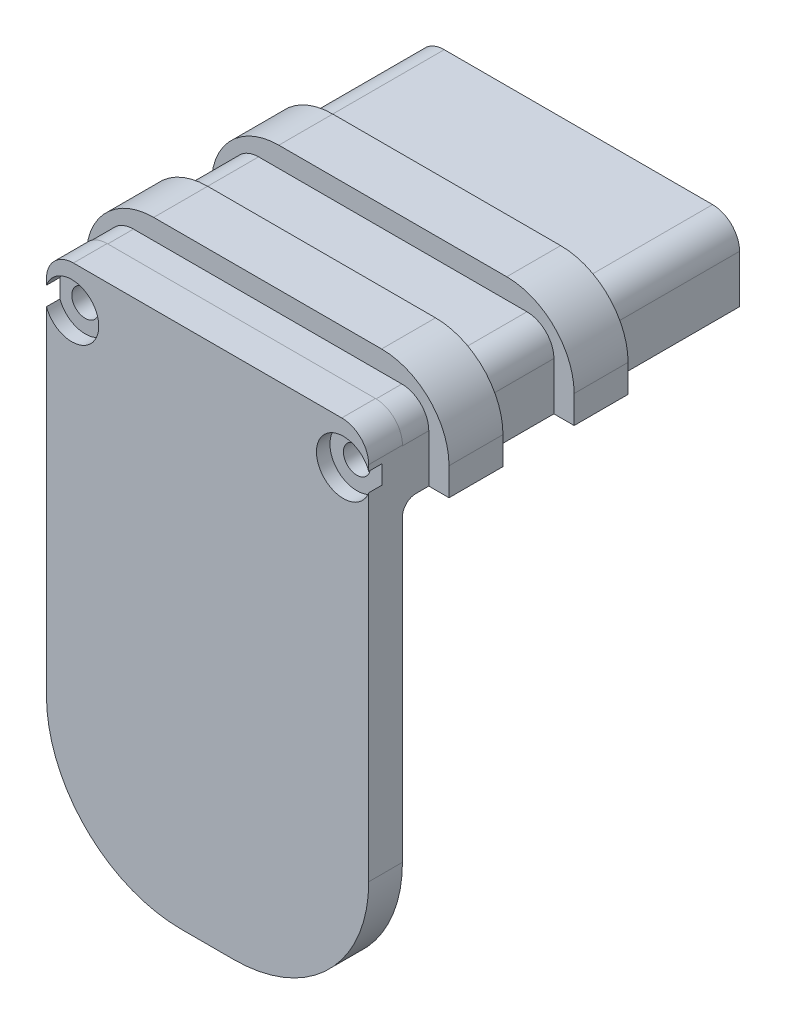
from build123d import *

# Parameters (mm, degrees)
SKETCH_1_W                = 32.6
SKETCH_1_H                = 34.6
SKETCH_1_R                = 1.25
SKETCH_1_W_2              = 24.6
SKETCH_1_H_2              = 24.2
EXTRUDE_1_DEPTH           = 13
SKETCH_3_W                = 6.5
SKETCH_3_H                = 6.519005167
CUT_EXTRUDE_1_DEPTH       = 19
SKETCH_4_W                = 6.5
SKETCH_4_H                = 6.467668889
CUT_EXTRUDE_2_DEPTH       = 23
EXTRUDE_2_DEPTH           = 50
SKETCH_1_2_W              = 22.27659965
SKETCH_1_2_H              = 4.598586669
SKETCH_1_2_W_2            = 22.283050596
SKETCH_1_2_H_2            = 4.977540741
CUT_EXTRUDE_5_DEPTH       = 34
FILLET_1_R                = 2
FILLET_2_R                = 2
SKETCH_9_W                = 54.594998093
SKETCH_9_H                = 18.111982385
SKETCH_9_W_2              = 52.534809486
SKETCH_9_H_2              = 12.989301534
CUT_EXTRUDE_6_DEPTH       = 41
FILLET_6_R                = 22
EXTRUDE_4_DEPTH           = 13
SKETCH_13_W               = 5.518907879
SKETCH_13_H               = 8.361822047
CUT_EXTRUDE_8_DEPTH       = 8.5
SKETCH_14_W               = 6.038657432
SKETCH_14_H               = 7.741248121
CUT_EXTRUDE_9_DEPTH       = 8.5
SKETCH_23_OUTSIDE_W       = 35.102
SKETCH_23_OUTSIDE_H       = 56.702
SKETCH_23_OUTSIDE_W_2     = 1.5
SKETCH_23_OUTSIDE_H_2     = 34.6
CUT_EXTRUDE_10_DEPTH      = 104
SKETCH_24_W               = 10.341780897
SKETCH_24_H               = 5.2
SKETCH_24_R               = 1.25
EXTRUDE_5_DEPTH           = 1.5
SKETCH_25_R               = 1.25
CUT_EXTRUDE_11_DEPTH      = 104
SKETCH_26_OUTSIDE_W       = 115.402
SKETCH_26_OUTSIDE_H       = 56.536
SKETCH_26_OUTSIDE_W_2     = 17.268409177
SKETCH_26_OUTSIDE_H_2     = 34.6
CUT_EXTRUDE_12_DEPTH      = 10
SKETCH_27_W               = 2.368409177
SKETCH_27_H               = 25.781356428
EXTRUDE_6_DEPTH           = 1.5
SKETCH_28_R               = 1.25
CUT_EXTRUDE_13_DEPTH      = 10
CUT_EXTRUDE_START         = -1.5
CUT_EXTRUDE_14_OUTLINE_W  = 0.368409177
CUT_EXTRUDE_14_OUTLINE_H  = 34.6
CUT_EXTRUDE_14_DEPTH      = 1.5
SKETCH_30_R               = 1
SKETCH_30_W               = 15.411127821
SKETCH_30_H               = 34.6
EXTRUDE_7_DEPTH           = 1.5
SKETCH_33_W               = 23.9
SKETCH_33_H               = 38.011921137
SKETCH_33_R               = 1.25
SKETCH_33_R_2             = 1
EXTRUDE_8_DEPTH           = 15
SKETCH_34_OUTSIDE_W       = 35.468
SKETCH_34_OUTSIDE_H       = 49.58
SKETCH_34_OUTSIDE_W_2     = 15.945908464
SKETCH_34_OUTSIDE_H_2     = 43.183358486
CUT_EXTRUDE_15_DEPTH      = 13.5
SKETCH_35_W               = 12.9
SKETCH_35_H               = 31.784162084
CUT_EXTRUDE_16_DEPTH      = 9.5
SKETCH_37_R               = 2.45
EXTRUDE_9_DEPTH           = 6.5
SKETCH_39_W               = 13.171271293
SKETCH_39_H               = 32.937459588
CUT_EXTRUDE_17_DEPTH      = 3
SKETCH_40_R               = 1
EXTRUDE_10_DEPTH          = 2.5
CUT_EXTRUDE_18_DEPTH      = 39.46624694
CUT_EXTRUDE_18_DEPTH_BACK = 39.46624694
SKETCH_41_W               = 23.981836835
SKETCH_41_H               = 47.1912102
SKETCH_42_R               = 2.4
EXTRUDE_11_DEPTH          = 5
FILLET_7_R                = 10
SKETCH_43_R               = 0.960722285
SKETCH_43_R_2             = 1
EXTRUDE_12_DEPTH          = 25
FILLET_9_R                = 2
SKETCH_44_R               = 2
CUT_EXTRUDE_19_DEPTH      = 1
SKETCH_45_W               = 26.9
SKETCH_45_H               = 4
EXTRUDE_13_DEPTH          = 1.5
SKETCH_46_W               = 1.5
SKETCH_46_H               = 4
EXTRUDE_14_DEPTH          = 5.557466787
FILLET_11_R               = 5
FILLET_14_R               = 1
FILLET_15_R               = 2
FILLET_16_R               = 2
FILLET_17_R               = 2
FILLET_18_R               = 2
FILLET_19_R               = 2
FILLET_20_R               = 2
FILLET_21_R               = 2
FILLET_22_R               = 2
SKETCH_47_R               = 5.136959448
EXTRUDE_15_DEPTH          = 1
FILLET_23_R               = 1
FILLET_24_R               = 0.5


# Read off the part's stored shape, not the designer's step: 切除-拉伸14
# Some blends are built 0.0001 mm under size
with BuildPart() as part:
    # Sketch 1 → 凸台-拉伸1 (new body)
    with BuildSketch(Plane.XY):
        with Locations((-9.850980392, 1.274712581)):
            Rectangle(SKETCH_1_W, SKETCH_1_H)
        with Locations(Location((-15.700980392, 15.424712581, 0), (0, 0, 180))):
            Circle(SKETCH_1_R, mode=Mode.SUBTRACT)
        with Locations(Location((-3.600980392, 15.424712581, 0), (0, 0, 180))):
            Circle(SKETCH_1_R, mode=Mode.SUBTRACT)
        with Locations(Location((-15.700980392, -12.875287419, 0), (0, 0, 180))):
            Circle(SKETCH_1_R, mode=Mode.SUBTRACT)
        with Locations(Location((-3.600980392, -12.875287419, 0), (0, 0, 180))):
            Circle(SKETCH_1_R, mode=Mode.SUBTRACT)
        with Locations((-9.850980392, 1.274712581)):
            Rectangle(SKETCH_1_W_2, SKETCH_1_H_2, mode=Mode.SUBTRACT)
    extrude(amount=EXTRUDE_1_DEPTH)

    # 草图3 → 切除-拉伸1 (cut)
    with BuildSketch(Plane(origin=(0, 0, 0), x_dir=(-1, 0, 0), z_dir=(0, 0, -1))):
        with Locations((15.700980392, -10.82528742)):
            Rectangle(SKETCH_3_W, SKETCH_3_H)
    extrude(amount=-CUT_EXTRUDE_1_DEPTH, mode=Mode.SUBTRACT)

    # 草图4 → 切除-拉伸2 (cut)
    with BuildSketch(Plane.XY.offset(13)):
        with Locations((-3.600980392, -10.82528742)):
            Rectangle(SKETCH_4_W, SKETCH_4_H)
    extrude(amount=-CUT_EXTRUDE_2_DEPTH, mode=Mode.SUBTRACT)

    # 草图5 → 凸台-拉伸2 (add)
    with BuildSketch(Plane(origin=(6.449019608, 0, 0), x_dir=(0, 0, -1), z_dir=(1, 0, 0))):
        Polygon((-13, 18.574712581), (-13, 10.055461473), (-13, -16.025287419), (0, -16.025287419), (0, -15.027567927), (0, 16.282461831), (0, 18.574712581), align=None)
    extrude(amount=EXTRUDE_2_DEPTH)

    # Sketch 1 2 → 切除-拉伸5 (cut)
    with BuildSketch(Plane.XY.offset(13)):
        with Locations((24.037173058, -7.263594431)):
            Rectangle(SKETCH_1_2_W, SKETCH_1_2_H)
        with Locations((24.078382453, 0.81654228)):
            Rectangle(SKETCH_1_2_W_2, SKETCH_1_2_H_2)
    extrude(amount=-CUT_EXTRUDE_5_DEPTH, mode=Mode.SUBTRACT)

    # 圆角1
    fillet_1_edges = [part.edges().sort_by_distance(p)[0] for p in [
        (12.936857155, -1.672228091, 6.5),
        (12.936857155, 3.30531265, 6.5),
        (35.219907751, 3.30531265, 6.5),
        (35.219907751, -1.672228091, 6.5),
        (12.898873233, -9.562887765, 6.5),
        (12.898873233, -4.964301096, 6.5),
        (35.175472883, -4.964301096, 6.5),
        (35.175472883, -9.562887765, 6.5),
    ]]
    fillet(fillet_1_edges, radius=FILLET_1_R)

    # 圆角2
    fillet_2_edges = [part.edges().sort_by_distance(p)[0] for p in [
        (-26.150980392, -16.025287419, 6.5),
        (-26.150980392, 18.574712581, 6.5),
    ]]
    fillet(fillet_2_edges, radius=FILLET_2_R)

    # 草图9 → 切除-拉伸6 (cut)
    with BuildSketch(Plane(origin=(0, 0, 0), x_dir=(-1, 0, 0), z_dir=(0, 0, -1))):
        with Locations((-36.934177516, 16.051357777)):
            Rectangle(SKETCH_9_W, SKETCH_9_H)
        with Locations((-36.653242706, -19.247200889)):
            Rectangle(SKETCH_9_W_2, SKETCH_9_H_2)
    extrude(amount=-CUT_EXTRUDE_6_DEPTH, mode=Mode.SUBTRACT)

    # 圆角6
    # the kernel refuses this fillet: 22 mm, written as the material it adds along each edge
    with BuildSketch(Plane(origin=(9.636678469, 6.995366584, 0), x_dir=(0, 1, 0), z_dir=(0, 0, 1))) as fillet_6_piece_1:
        with BuildLine():
            CenterArc((22, -19.375499223), FILLET_6_R, 118.272534833, 61.727465167)
            Line((0, -19.375499223), (-0.44, -19.375499223))
            Line((-0.44, -19.375499223), (-0.44, 0))
            Line((-0.44, 0), (0, 0.44))
            ThreePointArc((0, 0.44), (5.789672998, 0.44), (11.370932916, 0.387509984))
            Line((11.370932916, 0.387509984), (11.579345996, 0))
        make_face()
    extrude(amount=13)
    with BuildSketch(Plane(origin=(10.385837963, -12.752550122, 0), x_dir=(1, 0, 0), z_dir=(0, 0, 1))) as fillet_6_piece_2:
        with BuildLine():
            CenterArc((11.54511289, -22), FILLET_6_R, 90, 31.653290012)
            Line((0, -3.272737297), (-0.230902258, -2.898192043))
            ThreePointArc((-0.230902258, -2.898192043), (-0.44, -1.636368649), (-0.44, 0))
            Line((-0.44, 0), (0, 0.44))
            Line((0, 0.44), (11.54511289, 0.44))
            Line((11.54511289, 0.44), (11.54511289, 0))
        make_face()
    extrude(amount=13)

    # 草图12 → 凸台-拉伸4 (add)
    with BuildSketch(Plane(origin=(0, 0, 0), x_dir=(-1, 0, 0), z_dir=(0, 0, -1))):
        with BuildLine():
            Line((24.150980392, 18.574712581), (24.496655084, -15.99518818))
            ThreePointArc((24.496655084, -15.99518818), (37.015647173, 1.416671567), (24.150980392, 18.574712581))
        make_face()
        with BuildLine():
            Line((26.822698684, 1.289948959), (26.822698684, -8.431688638))
            ThreePointArc((26.822698684, -8.431688638), (32.027920461, 1.289948959), (26.822698684, 11.011586556))
            Line((26.822698684, 11.011586556), (26.822698684, 1.289948959))
        make_face(mode=Mode.SUBTRACT)
    extrude(amount=-EXTRUDE_4_DEPTH)

    # 草图13 → 切除-拉伸8 (cut)
    with BuildSketch(Plane.XY.offset(13)):
        with Locations((-3.600980393, 15.424712581)):
            Rectangle(SKETCH_13_W, SKETCH_13_H)
    extrude(amount=-CUT_EXTRUDE_8_DEPTH, mode=Mode.SUBTRACT)

    # 草图14 → 切除-拉伸9 (cut)
    with BuildSketch(Plane(origin=(0, 0, 0), x_dir=(-1, 0, 0), z_dir=(0, 0, -1))):
        with Locations((15.700980392, 15.424712581)):
            Rectangle(SKETCH_14_W, SKETCH_14_H)
    extrude(amount=-CUT_EXTRUDE_9_DEPTH, mode=Mode.SUBTRACT)

    # 草图23 outside → 切除-拉伸10 (cut)
    with BuildSketch(Plane(origin=(56.449019608, 0, 0), x_dir=(0, 0, -1), z_dir=(1, 0, 0))):
        with Locations((-6.5, 1.275)):
            Rectangle(SKETCH_23_OUTSIDE_W, SKETCH_23_OUTSIDE_H)
        with Locations((-12.25, 1.274712581)):
            Rectangle(SKETCH_23_OUTSIDE_W_2, SKETCH_23_OUTSIDE_H_2, mode=Mode.SUBTRACT)
    extrude(amount=-CUT_EXTRUDE_10_DEPTH, mode=Mode.SUBTRACT)

    # 草图24 → 凸台-拉伸5 (add)
    with BuildSketch(Plane.XY.offset(13)):
        with Locations((-4.17557206, 15.974712581)):
            Rectangle(SKETCH_24_W, SKETCH_24_H)
        with Locations((-3.600980392, 15.429779286)):
            Circle(SKETCH_24_R, mode=Mode.SUBTRACT)
    extrude(amount=-EXTRUDE_5_DEPTH)

    # 草图25 → 切除-拉伸11 (cut)
    with BuildSketch(Plane.XY.offset(13)):
        with Locations((42.624971711, -3.793205976)):
            Circle(SKETCH_25_R)
        with Locations((-34.434765713, 1.289948959)):
            Circle(SKETCH_25_R)
        with Locations((-25.484048207, 14.316394652)):
            Circle(SKETCH_25_R)
        with Locations((-25.484048207, -12.050711449)):
            Circle(SKETCH_25_R)
    extrude(amount=-CUT_EXTRUDE_11_DEPTH, mode=Mode.SUBTRACT)

    # 草图26 outside → 切除-拉伸12 (cut)
    with BuildSketch(Plane.XY.offset(13)):
        with Locations((9.716, 1.275)):
            Rectangle(SKETCH_26_OUTSIDE_W, SKETCH_26_OUTSIDE_H)
        with Locations((-15.516775803, 1.274712581)):
            Rectangle(SKETCH_26_OUTSIDE_W_2, SKETCH_26_OUTSIDE_H_2, mode=Mode.SUBTRACT)
    extrude(amount=-CUT_EXTRUDE_12_DEPTH, mode=Mode.SUBTRACT)

    # 草图27 → 凸台-拉伸6 (add)
    with BuildSketch(Plane.XY.offset(13)):
        with Locations((-8.066775804, 0.484034367)):
            Rectangle(SKETCH_27_W, SKETCH_27_H)
    extrude(amount=-EXTRUDE_6_DEPTH)

    # 草图28 → 切除-拉伸13 (cut)
    with BuildSketch(Plane.XY.offset(13)):
        with Locations((-19.200980392, 15.384992379)):
            Circle(SKETCH_28_R)
        with Locations((-12.200980392, 15.384992379)):
            Circle(SKETCH_28_R)
    extrude(amount=-CUT_EXTRUDE_13_DEPTH, mode=Mode.SUBTRACT)

    # 切除-拉伸14 outline → 切除-拉伸14 (cut)
    with BuildSketch(Plane.XY.offset(13).offset(CUT_EXTRUDE_START)):
        with Locations((-7.066775804, 1.274712581)):
            Rectangle(CUT_EXTRUDE_14_OUTLINE_W, CUT_EXTRUDE_14_OUTLINE_H)
    extrude(amount=CUT_EXTRUDE_14_DEPTH, mode=Mode.SUBTRACT)

    # 草图30 → 凸台-拉伸7 (add)
    with BuildSketch(Plane.XY.offset(13)):
        Polygon((-27.650980392, 18.574712581), (-27.650980392, -16.025287419), (-27.650980392, -17.319235473), (-3.750980392, -17.319235473), (-3.750980392, -16.025287419), (-3.750980392, 18.574712581), (-3.750980392, 20.692685664), (-27.650980392, 20.692685664), align=None)
        with Locations((-25.773264037, 17.574712581)):
            Circle(SKETCH_30_R, mode=Mode.SUBTRACT)
        with Locations((-5.628696747, 17.574712581)):
            Circle(SKETCH_30_R, mode=Mode.SUBTRACT)
        with Locations((-15.213421192, 1.274712581)):
            Rectangle(SKETCH_30_W, SKETCH_30_H, mode=Mode.SUBTRACT)
    extrude(amount=-EXTRUDE_7_DEPTH)

    # 草图33 → 凸台-拉伸8 (add)
    with BuildSketch(Plane(origin=(0, 0, 11.5), x_dir=(-1, 0, 0), z_dir=(0, 0, -1))):
        with Locations((15.700980392, 1.686725095)):
            Rectangle(SKETCH_33_W, SKETCH_33_H)
        with Locations((15.700980392, 15.424712581)):
            Circle(SKETCH_33_R, mode=Mode.SUBTRACT)
        with Locations(Location((12.200980392, 15.384992379, 0), (0, 0, 180))):
            Circle(SKETCH_33_R, mode=Mode.SUBTRACT)
        with Locations(Location((19.200980392, 15.384992379, 0), (0, 0, 180))):
            Circle(SKETCH_33_R, mode=Mode.SUBTRACT)
        with Locations(Location((25.773264037, 17.574712581, 0), (0, 0, 180))):
            Circle(SKETCH_33_R_2, mode=Mode.SUBTRACT)
        with Locations(Location((5.628696747, 17.574712581, 0), (0, 0, 180))):
            Circle(SKETCH_33_R_2, mode=Mode.SUBTRACT)
        with BuildLine():
            Line((9.250980392, -10.825287419), (12.450980392, -10.825287419))
            Line((12.450980392, -10.825287419), (12.450980392, -14.084790003))
            Line((12.450980392, -14.084790003), (15.385380168, -14.084790003))
            ThreePointArc((15.385380168, -14.084790003), (15.700980392, -14.125287419), (16.016580616, -14.084790003))
            Line((16.016580616, -14.084790003), (18.950980392, -14.084790003))
            Line((18.950980392, -14.084790003), (18.950980392, -10.825287419))
            Line((18.950980392, -10.825287419), (22.150980392, -10.825287419))
            Line((22.150980392, -10.825287419), (22.150980392, 13.374712581))
            Line((22.150980392, 13.374712581), (9.250980392, 13.374712581))
            Line((9.250980392, 13.374712581), (9.250980392, -10.825287419))
        make_face(mode=Mode.SUBTRACT)
    extrude(amount=EXTRUDE_8_DEPTH)

    # 草图34 outside → 切除-拉伸15 (cut)
    with BuildSketch(Plane.XY.offset(13)):
        with Locations((-15.701, 1.687)):
            Rectangle(SKETCH_34_OUTSIDE_W, SKETCH_34_OUTSIDE_H)
        with Locations((-15.700980392, 2.766642636)):
            Rectangle(SKETCH_34_OUTSIDE_W_2, SKETCH_34_OUTSIDE_H_2, mode=Mode.SUBTRACT)
    extrude(amount=-CUT_EXTRUDE_15_DEPTH, mode=Mode.SUBTRACT)

    # 草图35 → 切除-拉伸16 (cut)
    with BuildSketch(Plane.XY.offset(13)):
        with Locations((-15.700980392, 1.798395824)):
            Rectangle(SKETCH_35_W, SKETCH_35_H)
    extrude(amount=-CUT_EXTRUDE_16_DEPTH, mode=Mode.SUBTRACT)

    # 草图37 → 凸台-拉伸9 (add)
    with BuildSketch(Plane(origin=(0, 20.692685664, 0), x_dir=(1, 0, 0), z_dir=(0, 1, 0))):
        with Locations(Location((-15.700980392, -6.5, 0), (0, 0, 270))):
            Circle(SKETCH_37_R)
    extrude(amount=EXTRUDE_9_DEPTH)

    # 草图39 → 切除-拉伸17 (cut)
    with BuildSketch(Plane(origin=(0, 0, -3.5), x_dir=(-1, 0, 0), z_dir=(0, 0, -1))):
        with Locations((15.689641538, 1.922980187)):
            Rectangle(SKETCH_39_W, SKETCH_39_H)
    extrude(amount=-CUT_EXTRUDE_17_DEPTH, mode=Mode.SUBTRACT)

    # 草图40 → 凸台-拉伸10 (add)
    with BuildSketch(Plane(origin=(0, 0, -3.5), x_dir=(-1, 0, 0), z_dir=(0, 0, -1))):
        Polygon((3.750980392, 6.486167428), (3.750980392, -18.096742267), (27.650980392, -18.096742267), (27.650980392, 6.486167428), (27.650980392, 20.692685664), (3.750980392, 20.692685664), align=None)
        with Locations(Location((5.628696747, 17.574712581, 0), (0, 0, 180))):
            Circle(SKETCH_40_R, mode=Mode.SUBTRACT)
        with Locations(Location((25.773264037, 17.574712581, 0), (0, 0, 180))):
            Circle(SKETCH_40_R, mode=Mode.SUBTRACT)
    extrude(amount=EXTRUDE_10_DEPTH)

    # 草图41 → 切除-拉伸18 (cut, two sides: drawn at the far end of the back side and taken through both)
    with BuildSketch(Plane.ZY.offset(27.650980392).offset(-CUT_EXTRUDE_18_DEPTH_BACK)):
        with Locations((8.490918418, 6.276369627)):
            Rectangle(SKETCH_41_W, SKETCH_41_H)
    extrude(amount=CUT_EXTRUDE_18_DEPTH + CUT_EXTRUDE_18_DEPTH_BACK, mode=Mode.SUBTRACT)

    # 草图42 → 凸台-拉伸11 (add)
    with BuildSketch(Plane(origin=(0, 0, -6), x_dir=(-1, 0, 0), z_dir=(0, 0, -1))):
        with Locations(Location((15.700980392, -4.736742267, 0), (0, 0, 90))):
            Circle(SKETCH_42_R)
    extrude(amount=EXTRUDE_11_DEPTH)

    # 圆角7
    fillet_7_edges = [part.edges().sort_by_distance(p)[0] for p in [
        (-27.650980392, -18.096742267, -4.75),
        (-3.750980392, -18.096742267, -4.75),
    ]]
    fillet(fillet_7_edges, radius=FILLET_7_R)

    # 草图43 → 凸台-拉伸12 (add)
    with BuildSketch(Plane(origin=(0, 0, -6), x_dir=(-1, 0, 0), z_dir=(0, 0, -1))):
        Polygon((3.750980392, 15.086929107), (7.750980392, 15.086929107), (7.750980392, 18.644395894), (23.650980392, 18.644395894), (23.650980392, 15.086929107), (27.650980392, 15.086929107), (27.650980392, 20.644395894), (3.750980392, 20.644395894), align=None)
        with Locations(Location((5.628696747, 17.574712581, 0), (0, 0, 90))):
            Circle(SKETCH_43_R, mode=Mode.SUBTRACT)
        with Locations(Location((25.773264037, 17.574712581, 0), (0, 0, 180))):
            Circle(SKETCH_43_R_2, mode=Mode.SUBTRACT)
    extrude(amount=EXTRUDE_12_DEPTH)

    # 圆角9
    fillet_9_edges = [part.edges().sort_by_distance(p)[0] for p in [
        (-7.750980392, 15.086929107, -18.5),
        (-23.650980392, 15.086929107, -18.5),
    ]]
    fillet(fillet_9_edges, radius=FILLET_9_R)

    # 草图44 → 切除-拉伸19 (cut)
    with BuildSketch(Plane.XY.offset(-3.5)):
        with Locations((-5.628696747, 17.574712581)):
            Circle(SKETCH_44_R)
        with Locations((-25.773264037, 17.574712581)):
            Circle(SKETCH_44_R)
    extrude(amount=-CUT_EXTRUDE_19_DEPTH, mode=Mode.SUBTRACT)

    # 草图45 → 凸台-拉伸13 (add)
    with BuildSketch(Plane(origin=(0, 20.644395894, 0), x_dir=(1, 0, 0), z_dir=(0, 1, 0))):
        with Locations((-15.700980392, 19.232273158)):
            Rectangle(SKETCH_45_W, SKETCH_45_H)
        with Locations((-15.700980392, 9.954857037)):
            Rectangle(SKETCH_45_W, SKETCH_45_H)
    extrude(amount=EXTRUDE_13_DEPTH)

    # 草图46 → 凸台-拉伸14 (add)
    with BuildSketch(Plane.XZ.offset(-20.644395894)):
        with Locations((-3.000980392, -9.954857037)):
            Rectangle(SKETCH_46_W, SKETCH_46_H)
        with Locations((-3.000980392, -19.232273158)):
            Rectangle(SKETCH_46_W, SKETCH_46_H)
        with Locations((-28.400980392, -19.232273158)):
            Rectangle(SKETCH_46_W, SKETCH_46_H)
        with Locations((-28.400980392, -9.954857037)):
            Rectangle(SKETCH_46_W, SKETCH_46_H)
    extrude(amount=EXTRUDE_14_DEPTH)

    # 圆角11
    fillet_11_edges = [part.edges().sort_by_distance(p)[0] for p in [
        (-29.150980392, 22.144395894, -19.232273158),
        (-2.250980392, 22.144395894, -19.232273158),
        (-29.150980392, 22.144395894, -9.954857037),
        (-2.250980392, 22.144395894, -9.954857037),
    ]]
    fillet(fillet_11_edges, radius=FILLET_11_R)

    # 圆角14
    fillet_14_edges = [part.edges().sort_by_distance(p)[0] for p in [
        (-7.750980392, 17.865662501, -6),
        (-26.650980392, 15.086929107, -6),
        (-7.165193955, 15.672715545, -6),
        (-24.23676683, 15.672715545, -6),
        (-4.750980392, 15.086929107, -6),
        (-15.700980392, 18.644395894, -6),
        (-23.650980392, 17.865662501, -6),
    ]]
    fillet(fillet_14_edges, radius=FILLET_14_R)

    # 圆角15
    fillet_15_edges = [part.edges().sort_by_distance(p)[0] for p in [
        (-27.650980392, 20.644395894, -6.977428519),
    ]]
    fillet(fillet_15_edges, radius=FILLET_15_R)

    # 圆角16
    fillet_16_edges = [part.edges().sort_by_distance(p)[0] for p in [
        (-27.650980392, 20.692685664, -4.75),
    ]]
    fillet(fillet_16_edges, radius=FILLET_16_R)

    # 圆角17
    fillet_17_edges = [part.edges().sort_by_distance(p)[0] for p in [
        (-27.650980392, 20.644395894, -14.593565098),
    ]]
    fillet(fillet_17_edges, radius=FILLET_17_R)

    # 圆角18
    fillet_18_edges = [part.edges().sort_by_distance(p)[0] for p in [
        (-27.650980392, 20.644395894, -26.116136579),
    ]]
    fillet(fillet_18_edges, radius=FILLET_18_R)

    # 圆角19
    fillet_19_edges = [part.edges().sort_by_distance(p)[0] for p in [
        (-3.750980392, 20.644395894, -26.116136579),
    ]]
    fillet(fillet_19_edges, radius=FILLET_19_R)

    # 圆角20
    fillet_20_edges = [part.edges().sort_by_distance(p)[0] for p in [
        (-3.750980392, 20.644395894, -14.593565098),
    ]]
    fillet(fillet_20_edges, radius=FILLET_20_R)

    # 圆角21
    fillet_21_edges = [part.edges().sort_by_distance(p)[0] for p in [
        (-3.750980392, 20.644395894, -6.977428519),
    ]]
    fillet(fillet_21_edges, radius=FILLET_21_R)

    # 圆角22
    fillet_22_edges = [part.edges().sort_by_distance(p)[0] for p in [
        (-3.750980392, 20.692685664, -4.75),
    ]]
    fillet(fillet_22_edges, radius=FILLET_22_R)

    # 草图47 → 凸台-拉伸15 (add)
    with BuildSketch(Plane(origin=(0, 0, -6), x_dir=(-1, 0, 0), z_dir=(0, 0, -1))):
        with Locations(Location((15.700980392, -4.736742267, 0), (0, 0, 90))):
            Circle(SKETCH_47_R)
    extrude(amount=EXTRUDE_15_DEPTH)

    # 圆角23
    fillet_23_edges = [part.edges().sort_by_distance(p)[0] for p in [
        (-15.700980392, -9.873701716, -6),
    ]]
    fillet(fillet_23_edges, radius=FILLET_23_R - 0.0001)  # a hair under: the kernel refuses the full size

    # 圆角24
    fillet_24_edges = [part.edges().sort_by_distance(p)[0] for p in [
        (-15.700980392, -7.136742267, -11),
    ]]
    fillet(fillet_24_edges, radius=FILLET_24_R)


solid = part.part
